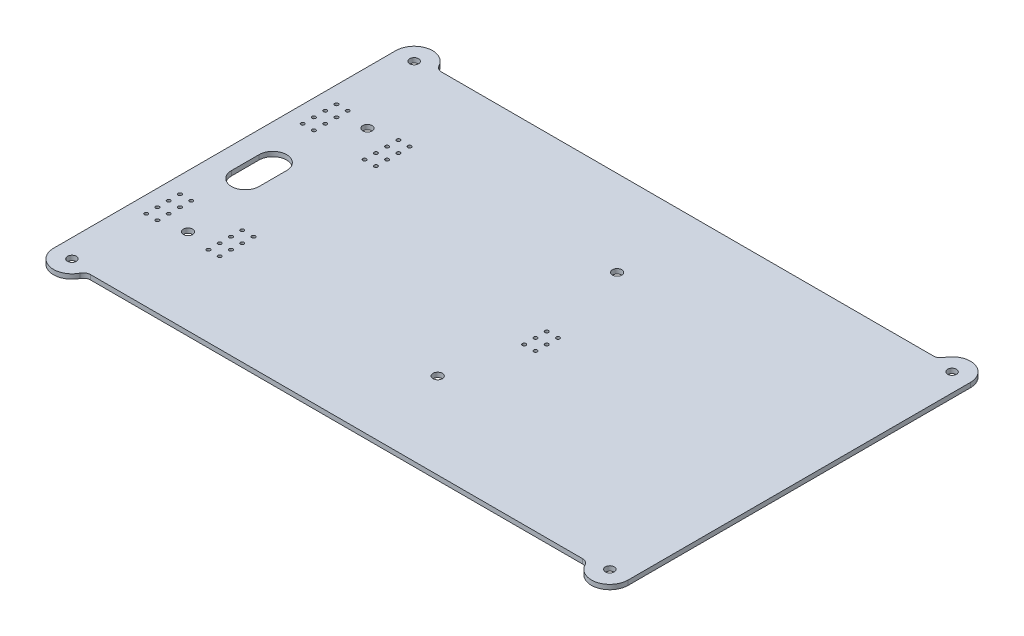
from build123d import *

# Parameters (mm, degrees)
BOSS_EXTRUDE1_DEPTH = 1.5875
SKETCH2_R           = 1.5875
CUT_EXTRUDE1_DEPTH  = 151.205819323
CUT_EXTRUDE2_DEPTH  = 151.205819323
SKETCH7_R           = 0.6
CUT_EXTRUDE3_DEPTH  = 151.205819323
SKETCH9_R           = 1.5
CUT_EXTRUDE4_DEPTH  = 151.205819323


with BuildPart() as part:
    # Sketch1 → Boss-Extrude1 (new body)
    with BuildSketch(Plane(origin=(0, 0, 0), x_dir=(1, 0, 0), z_dir=(0, 1, 0))):
        with BuildLine():
            Line((-58.612, -57.8993), (-58.612, 57.8993))
            ThreePointArc((-58.612, 57.8993), (-53.855945029, 63.945953336), (-46.859052216, 60.74820938))
            ThreePointArc((-46.859052216, 60.74820938), (-45.92336885, 59.742649624), (-44.600975438, 59.371261083))
            Line((-44.600975438, 59.371261083), (121.811497604, 59.371261083))
            ThreePointArc((121.811497604, 59.371261083), (123.133891016, 59.742649624), (124.069574382, 60.74820938))
            ThreePointArc((124.069574382, 60.74820938), (131.066467196, 63.945953336), (135.822522167, 57.8993))
            Line((135.822522167, 57.8993), (135.822522167, -57.8993))
            ThreePointArc((135.822522167, -57.8993), (131.066467196, -63.945953336), (124.069574382, -60.74820938))
            ThreePointArc((124.069574382, -60.74820938), (123.133891016, -59.742649624), (121.811497604, -59.371261083))
            Line((121.811497604, -59.371261083), (-44.600975438, -59.371261083))
            ThreePointArc((-44.600975438, -59.371261083), (-45.92336885, -59.742649624), (-46.859052216, -60.74820938))
            ThreePointArc((-46.859052216, -60.74820938), (-53.855945029, -63.945953336), (-58.612, -57.8993))
        make_face()
    extrude(amount=-BOSS_EXTRUDE1_DEPTH)

    # Sketch2 → Cut-Extrude1 (cut, through all)
    with BuildSketch(Plane(origin=(0, 0, 0), x_dir=(1, 0, 0), z_dir=(0, 1, 0))):
        with Locations((-40.6725, -30.35)):
            Circle(SKETCH2_R)
        with Locations((-40.6725, 30.35)):
            Circle(SKETCH2_R)
        with Locations((43.8275, 30.35)):
            Circle(SKETCH2_R)
        with Locations((43.8275, -30.35)):
            Circle(SKETCH2_R)
    extrude(amount=-CUT_EXTRUDE1_DEPTH, mode=Mode.SUBTRACT)

    # Sketch3 → Cut-Extrude2 (cut, through all)
    with BuildSketch(Plane(origin=(0, 0, 0), x_dir=(1, 0, 0), z_dir=(0, 1, 0))):
        with BuildLine():
            Line((-41.933471413, 4.284952831), (-41.933471413, -5.034952831))
            ThreePointArc((-41.933471413, -5.034952831), (-46.603471413, -9.704952831), (-51.273471413, -5.034952831))
            Line((-51.273471413, -5.034952831), (-51.273471413, 4.284952831))
            ThreePointArc((-51.273471413, 4.284952831), (-46.603471413, 8.954952831), (-41.933471413, 4.284952831))
        make_face()
    extrude(amount=-CUT_EXTRUDE2_DEPTH, mode=Mode.SUBTRACT)

    # Sketch7 → Cut-Extrude3 (cut, through all)
    with BuildSketch(Plane.XZ.offset(1.5875)):
        with Locations((49.2175, 6.483)):
            Circle(SKETCH7_R)
        with Locations((-49.1085, -32.125)):
            Circle(SKETCH7_R)
        with Locations((-28.1535, -32.125)):
            Circle(SKETCH7_R)
        with Locations((-28.1535, 20.707)):
            Circle(SKETCH7_R)
        with Locations((-49.2355, 20.707)):
            Circle(SKETCH7_R)
        with Locations((-31.9635, 20.707)):
            Circle(SKETCH7_R)
        with Locations((-53.0455, 20.707)):
            Circle(SKETCH7_R)
        with Locations((-31.9635, 28.327)):
            Circle(SKETCH7_R)
        with Locations((-53.0455, 28.327)):
            Circle(SKETCH7_R)
        with Locations((-31.9635, 24.517)):
            Circle(SKETCH7_R)
        with Locations((-53.0455, 24.517)):
            Circle(SKETCH7_R)
        with Locations((-31.9635, -28.315)):
            Circle(SKETCH7_R)
        with Locations((-52.9185, -28.315)):
            Circle(SKETCH7_R)
        with Locations((-31.9635, -32.125)):
            Circle(SKETCH7_R)
        with Locations((-52.9185, -32.125)):
            Circle(SKETCH7_R)
        with Locations((-28.1535, 24.517)):
            Circle(SKETCH7_R)
        with Locations((-49.2355, 24.517)):
            Circle(SKETCH7_R)
        with Locations((-31.9635, 32.137)):
            Circle(SKETCH7_R)
        with Locations((-53.0455, 32.137)):
            Circle(SKETCH7_R)
        with Locations((-31.9635, -20.695)):
            Circle(SKETCH7_R)
        with Locations((-52.9185, -20.695)):
            Circle(SKETCH7_R)
        with Locations((-31.9635, -24.505)):
            Circle(SKETCH7_R)
        with Locations((-52.9185, -24.505)):
            Circle(SKETCH7_R)
        with Locations((-28.1535, 32.137)):
            Circle(SKETCH7_R)
        with Locations((-49.2355, 32.137)):
            Circle(SKETCH7_R)
        with Locations((-28.1535, 28.327)):
            Circle(SKETCH7_R)
        with Locations((-49.2355, 28.327)):
            Circle(SKETCH7_R)
        with Locations((-28.1535, -24.505)):
            Circle(SKETCH7_R)
        with Locations((-49.1085, -24.505)):
            Circle(SKETCH7_R)
        with Locations((-28.1535, -28.315)):
            Circle(SKETCH7_R)
        with Locations((-49.1085, -28.315)):
            Circle(SKETCH7_R)
        with Locations((49.2175, 2.673)):
            Circle(SKETCH7_R)
        with Locations((53.0275, -1.137)):
            Circle(SKETCH7_R)
        with Locations((53.0275, 2.673)):
            Circle(SKETCH7_R)
        with Locations((53.0275, 6.483)):
            Circle(SKETCH7_R)
        with Locations((-28.1535, -20.695)):
            Circle(SKETCH7_R)
        with Locations((-49.1085, -20.695)):
            Circle(SKETCH7_R)
        with Locations((49.2175, -1.137)):
            Circle(SKETCH7_R)
    extrude(amount=-CUT_EXTRUDE3_DEPTH, mode=Mode.SUBTRACT)

    # Sketch9 → Cut-Extrude4 (cut, through all)
    with BuildSketch(Plane(origin=(0, 0, 0), x_dir=(1, 0, 0), z_dir=(0, 1, 0))):
        with Locations((-52.390238917, 57.8993)):
            Circle(SKETCH9_R)
        with Locations((-52.390238917, -57.8993)):
            Circle(SKETCH9_R)
        with Locations((129.600761083, 57.8993)):
            Circle(SKETCH9_R)
        with Locations((129.600761083, -57.8993)):
            Circle(SKETCH9_R)
    extrude(amount=-CUT_EXTRUDE4_DEPTH, mode=Mode.SUBTRACT)


solid = part.part
